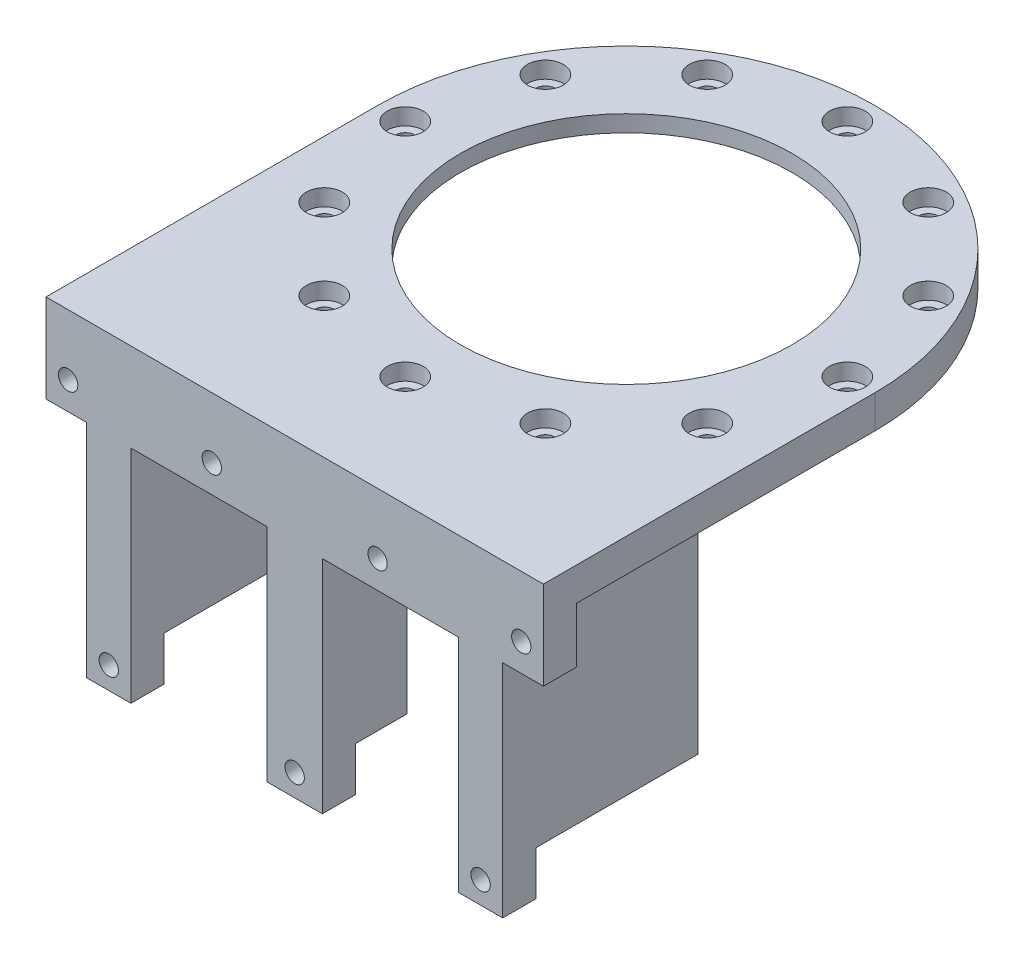
from build123d import *

# Parameters (mm, degrees)
SKETCH1_R           = 45
SKETCH1_R_2         = 30
SKETCH1_R_3         = 1.75
BOSS_EXTRUDE1_DEPTH = 6
SKETCH2_R           = 36
CUT_EXTRUDE1_DEPTH  = 3
SKETCH3_R           = 3.25
CUT_EXTRUDE2_DEPTH  = 3
BOSS_EXTRUDE4_DEPTH = 6
SKETCH5_W           = 90
SKETCH5_H           = 6
BOSS_EXTRUDE6_DEPTH = 10
BOSS_EXTRUDE7_START = 50
BOSS_EXTRUDE7_DEPTH = 50
SKETCH7_W           = 29.339223388
SKETCH7_H           = 8
CUT_EXTRUDE3_DEPTH  = 114.708124382
SKETCH8_R           = 1.75
CUT_EXTRUDE5_DEPTH  = 120.691269523


with BuildPart() as part:
    # Sketch1 → Boss-Extrude1 (new body)
    with BuildSketch(Plane(origin=(0, 0, 0), x_dir=(1, 0, 0), z_dir=(0, 1, 0))):
        Circle(SKETCH1_R)
        Circle(SKETCH1_R_2, mode=Mode.SUBTRACT)
        with Locations((0, 40)):
            Circle(SKETCH1_R_3, mode=Mode.SUBTRACT)
        with Locations((20, 34.641016151)):
            Circle(SKETCH1_R_3, mode=Mode.SUBTRACT)
        with Locations((34.641016151, 20)):
            Circle(SKETCH1_R_3, mode=Mode.SUBTRACT)
        with Locations((40, 0)):
            Circle(SKETCH1_R_3, mode=Mode.SUBTRACT)
        with Locations((34.641016151, -20)):
            Circle(SKETCH1_R_3, mode=Mode.SUBTRACT)
        with Locations((20, -34.641016151)):
            Circle(SKETCH1_R_3, mode=Mode.SUBTRACT)
        with Locations((0, -40)):
            Circle(SKETCH1_R_3, mode=Mode.SUBTRACT)
        with Locations((-20, -34.641016151)):
            Circle(SKETCH1_R_3, mode=Mode.SUBTRACT)
        with Locations((-34.641016151, -20)):
            Circle(SKETCH1_R_3, mode=Mode.SUBTRACT)
        with Locations((-40, 0)):
            Circle(SKETCH1_R_3, mode=Mode.SUBTRACT)
        with Locations((-34.641016151, 20)):
            Circle(SKETCH1_R_3, mode=Mode.SUBTRACT)
        with Locations((-20, 34.641016151)):
            Circle(SKETCH1_R_3, mode=Mode.SUBTRACT)
    extrude(amount=BOSS_EXTRUDE1_DEPTH)

    # Sketch2 → Cut-Extrude1 (cut)
    with BuildSketch(Plane.XZ):
        Circle(SKETCH2_R)
    extrude(amount=-CUT_EXTRUDE1_DEPTH, mode=Mode.SUBTRACT)

    # Sketch3 → Cut-Extrude2 (cut)
    with BuildSketch(Plane(origin=(0, 6, 0), x_dir=(1, 0, 0), z_dir=(0, 1, 0))):
        with Locations((40, 0)):
            Circle(SKETCH3_R)
        with Locations((34.641016151, -20)):
            Circle(SKETCH3_R)
        with Locations((20, -34.641016151)):
            Circle(SKETCH3_R)
        with Locations((0, -40)):
            Circle(SKETCH3_R)
        with Locations((-20, -34.641016151)):
            Circle(SKETCH3_R)
        with Locations((-34.641016151, -20)):
            Circle(SKETCH3_R)
        with Locations((-40, 0)):
            Circle(SKETCH3_R)
        with Locations((-34.641016151, 20)):
            Circle(SKETCH3_R)
        with Locations((-20, 34.641016151)):
            Circle(SKETCH3_R)
        with Locations((0, 40)):
            Circle(SKETCH3_R)
        with Locations((20, 34.641016151)):
            Circle(SKETCH3_R)
        with Locations((34.641016151, 20)):
            Circle(SKETCH3_R)
    extrude(amount=-CUT_EXTRUDE2_DEPTH, mode=Mode.SUBTRACT)

    # Sketch4 → Boss-Extrude4 (add)
    with BuildSketch(Plane.XZ):
        with BuildLine():
            Line((45, 0), (45, 60))
            Line((45, 60), (-45, 60))
            Line((-45, 60), (-45, 0))
            ThreePointArc((-45, 0), (0, 45), (45, 0))
        make_face()
    extrude(amount=-BOSS_EXTRUDE4_DEPTH)

    # Sketch5 → Boss-Extrude6 (add)
    with BuildSketch(Plane.XZ):
        with Locations((0, 57)):
            Rectangle(SKETCH5_W, SKETCH5_H)
    extrude(amount=BOSS_EXTRUDE6_DEPTH)

    # Sketch6 → Boss-Extrude7 (add)
    with BuildSketch(Plane.XZ.offset(BOSS_EXTRUDE7_START)):
        with BuildLine():
            Line((37.641016151, 24.660776612), (37.641016151, 60))
            Line((37.641016151, 60), (29.641016151, 60))
            Line((29.641016151, 60), (29.641016151, 33.858679264))
            ThreePointArc((29.641016151, 33.858679264), (33.953914664, 29.531875643), (37.641016151, 24.660776612))
        make_face()
        with BuildLine():
            Line((-5, 60), (5, 60))
            Line((5, 60), (5, 44.72135955))
            ThreePointArc((5, 44.72135955), (0, 45), (-5, 44.72135955))
            Line((-5, 44.72135955), (-5, 60))
        make_face()
        with BuildLine():
            Line((-29.641016151, 60), (-29.641016151, 33.858679264))
            ThreePointArc((-29.641016151, 33.858679264), (-33.953914664, 29.531875643), (-37.641016151, 24.660776612))
            Line((-37.641016151, 24.660776612), (-37.641016151, 60))
            Line((-37.641016151, 60), (-29.641016151, 60))
        make_face()
    extrude(amount=-BOSS_EXTRUDE7_DEPTH)

    # Sketch7 → Cut-Extrude3 (cut, through all)
    with BuildSketch(Plane(origin=(37.641016151, 0, 0), x_dir=(0, 0, -1), z_dir=(1, 0, 0))):
        with Locations((-39.330388306, -46)):
            Rectangle(SKETCH7_W, SKETCH7_H)
    extrude(amount=-CUT_EXTRUDE3_DEPTH, mode=Mode.SUBTRACT)

    # Sketch8 → Cut-Extrude5 (cut, through all)
    with BuildSketch(Plane(origin=(0, 0, 54), x_dir=(-1, 0, 0), z_dir=(0, 0, -1))):
        with Locations((41, -5)):
            Circle(SKETCH8_R)
        with Locations((33.641016151, -46)):
            Circle(SKETCH8_R)
        with Locations((0, -46)):
            Circle(SKETCH8_R)
        with Locations((15, -5)):
            Circle(SKETCH8_R)
        with Locations((-33.641016151, -46)):
            Circle(SKETCH8_R)
        with Locations((-41, -5)):
            Circle(SKETCH8_R)
        with Locations((-15, -5)):
            Circle(SKETCH8_R)
    extrude(amount=-CUT_EXTRUDE5_DEPTH, mode=Mode.SUBTRACT)


solid = part.part
